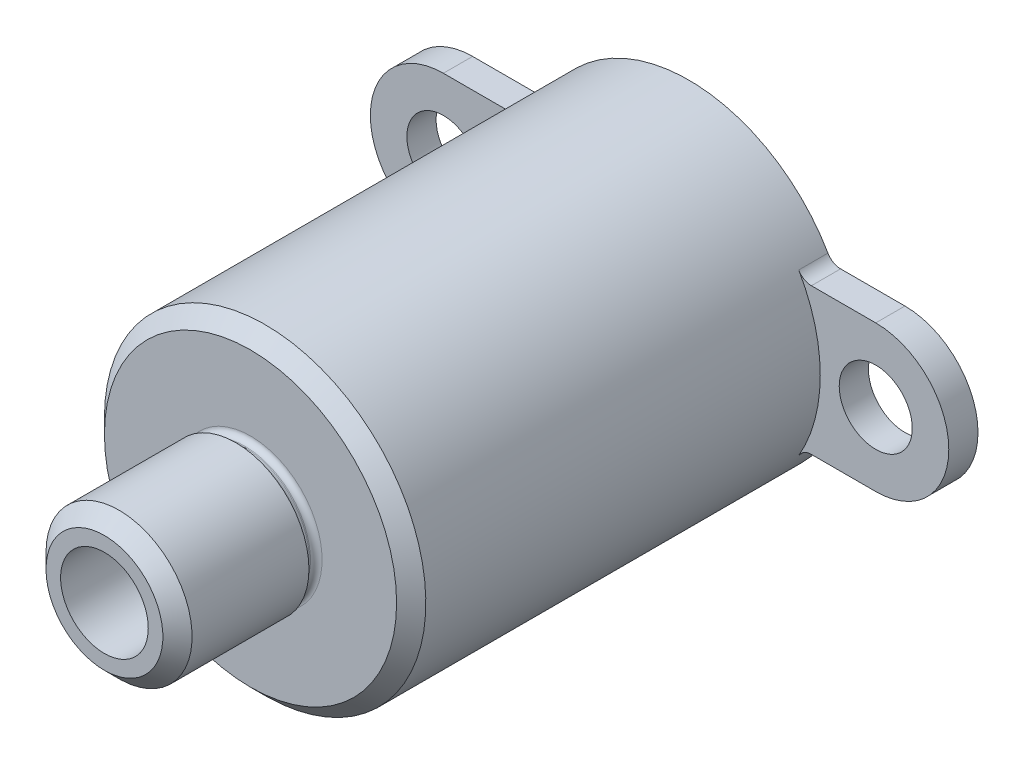
from build123d import *

# Parameters (mm, degrees)
FILLET_1_R            = 0.4
FILLET_2_R            = 0.2
CHAMFER_1_SIZE        = 1
FILLET_3_R            = 1
EXTRUDE_START         = -2
EXTRUDE_1_DEPTH       = 2
HOLE_WIZARD_5_0_5_1_D = 5
CHAMFER_2_SIZE        = 0.5
FILLET_4_R            = 1


with BuildPart() as part:
    # Эскиз1 → Повернуть1 (revolve)
    with BuildSketch(Plane(origin=(0, 0, 0), x_dir=(0, 0, -1), z_dir=(1, 0, 0))):
        Polygon((30, 11), (0, 11), (0, 5), (-10, 5), (-10, 3), (2, 3), (2, 8), (25, 8), (25, 10), (30, 10), align=None)
    revolve(axis=Axis((0, 0, 28.642974124), (0, 0, -1)))

    # Эскиз2 → Вырез-Повернуть1 (revolve, cut)
    with BuildSketch(Plane(origin=(0, 0, 0), x_dir=(1, 0, 0), z_dir=(0, 1, 0))):
        Polygon((4.5, 0), (5, 0), (5, -1), (4.5, -0.7), align=None)
    revolve(axis=Axis((0, 0, 0), (0, 0, 1)), mode=Mode.SUBTRACT)

    # Скругление1
    fillet_1_edges = [part.edges().sort_by_distance(p)[0] for p in [
        (-4.5, 0, 0),
        (-4.5, 0, 0.7),
    ]]
    fillet(fillet_1_edges, radius=FILLET_1_R)

    # Эскиз3 → Вырез-Повернуть2 (revolve, cut)
    with BuildSketch(Plane(origin=(0, 0, 0), x_dir=(1, 0, 0), z_dir=(0, 1, 0))):
        Polygon((-10, 25), (-10.223606798, 25), (-10.223606798, 25.5), (-10, 25.7), align=None)
    revolve(axis=Axis((0, 0, 0), (0, 0, -1)), mode=Mode.SUBTRACT)

    # Скругление2
    fillet_2_edges = [part.edges().sort_by_distance(p)[0] for p in [
        (10.223606798, 0, -25.5),
        (10.223606798, 0, -25),
    ]]
    fillet(fillet_2_edges, radius=FILLET_2_R)

    # Фаска1
    chamfer_1_edges = [part.edges().sort_by_distance(p)[0] for p in [
        (0, -5, 10),
        (0, -8, -25),
        (0, -11, 0),
    ]]
    chamfer(chamfer_1_edges, length=CHAMFER_1_SIZE)

    # Скругление3
    fillet_3_edges = [part.edges().sort_by_distance(p)[0] for p in [
        (0, -8, -2),
    ]]
    fillet(fillet_3_edges, radius=FILLET_3_R)

    # Эскиз4 → Бобышка-Вытянуть1 (add)
    with BuildSketch(Plane(origin=(0, 0, -30), x_dir=(-1, 0, 0), z_dir=(0, 0, -1)).offset(EXTRUDE_START)):
        with BuildLine():
            Line((-14.797958971, 5), (-9.797958971, 5))
            ThreePointArc((-9.797958971, 5), (-11, 0), (-9.797958971, -5))
            Line((-9.797958971, -5), (-14.797958971, -5))
            ThreePointArc((-14.797958971, -5), (-19.797958971, 0), (-14.797958971, 5))
        make_face()
    extrude_1 = extrude(amount=EXTRUDE_1_DEPTH)

    # Диаметр отверстия Ø5.0 (5)1 (through all)
    with Locations(Plane(origin=(0, 0, -30), x_dir=(-1, 0, 0), z_dir=(0, 0, -1))):
        with Locations((-14.797958971, 0)):
            hole_wizard_5_0_5_1 = Hole(HOLE_WIZARD_5_0_5_1_D / 2)

    # Зеркальное отражение1: Бобышка-Вытянуть1, Диаметр отверстия Ø5.0 (5)1 across plane
    add(extrude_1.mirror(Plane(origin=(0, 0, 0), x_dir=(0, 0, 1), z_dir=(1, 0, 0))))
    add(hole_wizard_5_0_5_1.mirror(Plane(origin=(0, 0, 0), x_dir=(0, 0, 1), z_dir=(1, 0, 0))), mode=Mode.SUBTRACT)

    # Фаска2
    chamfer_2_edges = [part.edges().sort_by_distance(p)[0] for p in [
        (0, -10, -30),
    ]]
    chamfer(chamfer_2_edges, length=CHAMFER_2_SIZE)

    # Скругление4
    fillet_4_edges = [part.edges().sort_by_distance(p)[0] for p in [
        (-9.797958971, -5, -29),
        (-9.797958971, 5, -29),
        (9.797958971, -5, -29),
        (9.797958971, 5, -29),
    ]]
    fillet(fillet_4_edges, radius=FILLET_4_R)


solid = part.part
